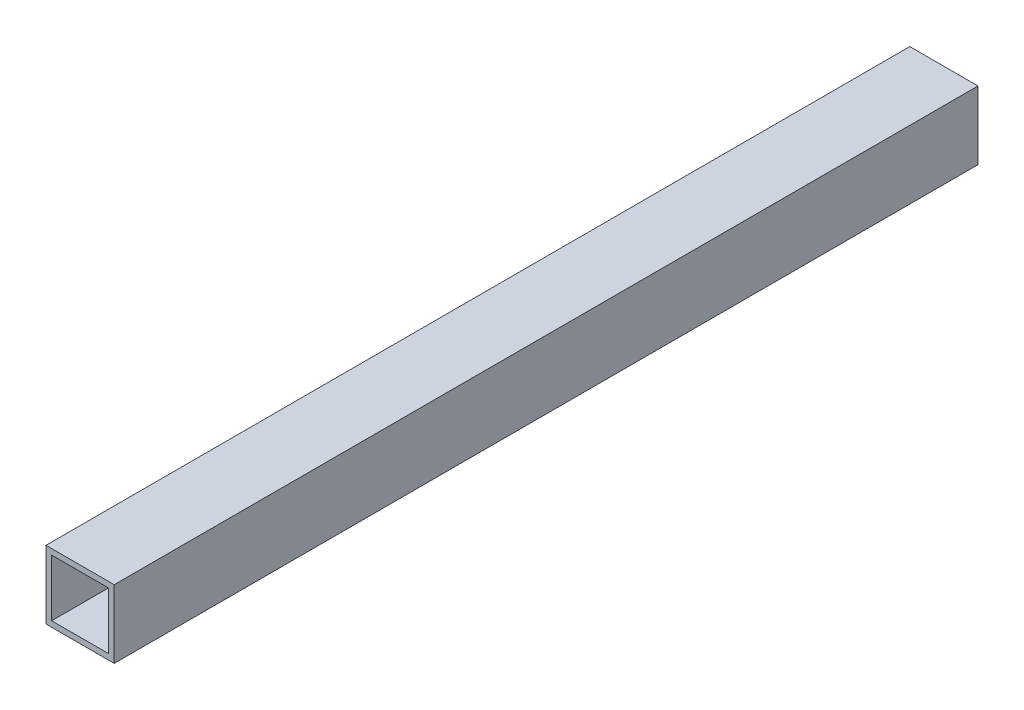
from build123d import *

# Parameters (mm, degrees)
SKETCH2_W           = 38.1
SKETCH2_H           = 38.1
SKETCH2_W_2         = 31.75
SKETCH2_H_2         = 31.75
BOSS_EXTRUDE1_DEPTH = 482.6


with BuildPart() as part:
    # Sketch2 → Boss-Extrude1 (new body)
    with BuildSketch(Plane.XY):
        Rectangle(SKETCH2_W, SKETCH2_H)
        Rectangle(SKETCH2_W_2, SKETCH2_H_2, mode=Mode.SUBTRACT)
    extrude(amount=BOSS_EXTRUDE1_DEPTH)


solid = part.part
